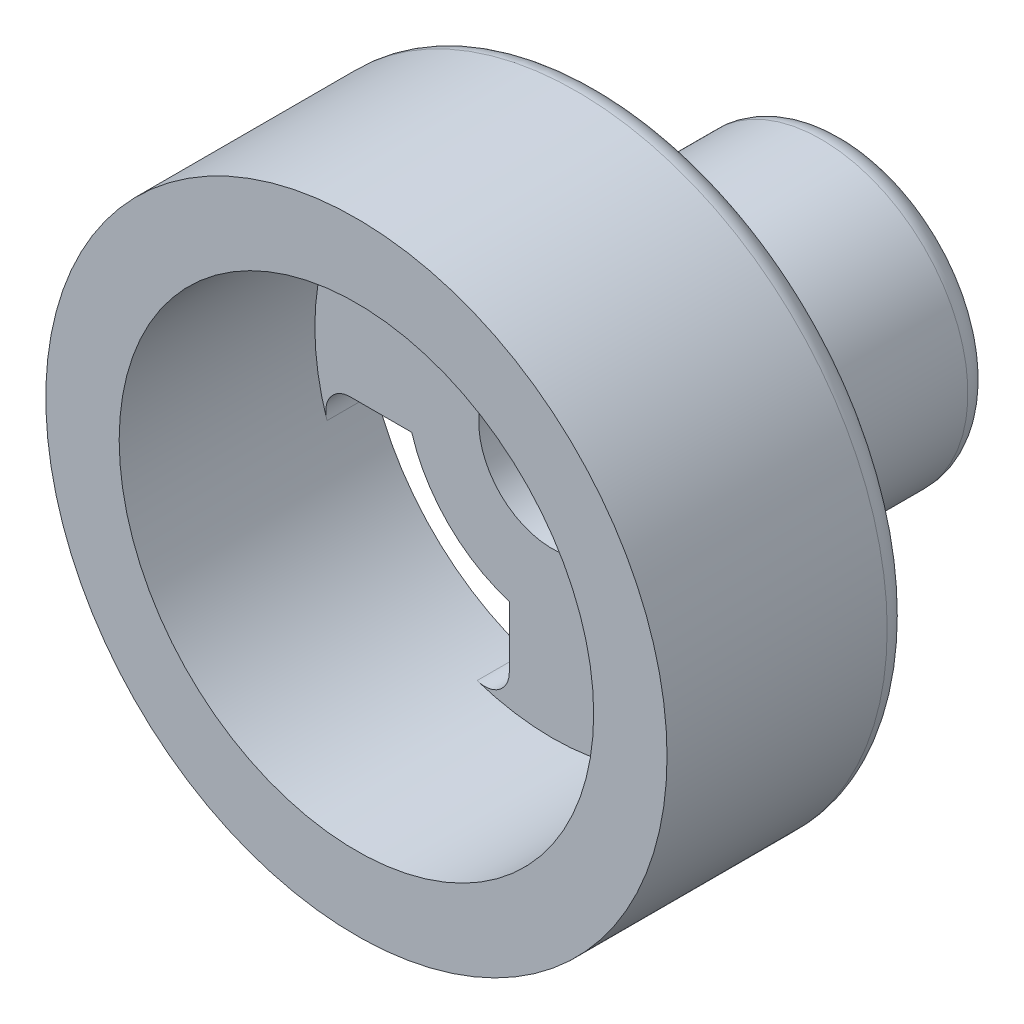
from build123d import *
from build123d.topology import SkipClean

# Parameters (mm, degrees)
ESBO_O1_R                = 12.7
ESBO_O1_R_2              = 9.7
ESBO_O1_R_3              = 3
RESSALTO_EXTRUS_O1_DEPTH = 10
ESBO_O1_3_R              = 9.7
ESBO_O1_3_R_2            = 3
CORTE_EXTRUS_O1_DEPTH    = 8
CORTE_EXTRUS_O3_START    = -2
CORTE_EXTRUS_O3_DEPTH    = 2
FILETE1_R                = 1
ESBO_O2_5_R              = 6
ESBO_O2_5_R_2            = 3
RESSALTO_EXTRUS_O2_DEPTH = 10
FILETE2_R                = 1
FILETE3_R                = 1
FILETE4_R                = 1


with BuildPart() as part:
    # Esboço1 → Ressalto-extrusão1 (new body)
    # profile 1 of 2: a face of its own
    with BuildSketch(Plane.XY):
        Circle(ESBO_O1_R)
        Circle(ESBO_O1_R_2, mode=Mode.SUBTRACT)
    # profile 2 of 2: a face of its own
    with BuildSketch(Plane.XY):
        Circle(ESBO_O1_R_2)
        Circle(ESBO_O1_R_3, mode=Mode.SUBTRACT)
    extrude(amount=-RESSALTO_EXTRUS_O1_DEPTH)

    # Esboço1<3> → Corte-extrusão1 (cut)
    with BuildSketch(Plane.XY):
        Circle(ESBO_O1_3_R)
        Circle(ESBO_O1_3_R_2, mode=Mode.SUBTRACT)
    extrude(amount=-CORTE_EXTRUS_O1_DEPTH, mode=Mode.SUBTRACT)

    # Esboço2 → Corte-extrusão3 (cut)
    with SkipClean():  # the faces are left unmerged after this step: merging them gives an invalid solid
        with BuildSketch(Plane(origin=(0, 0, -10), x_dir=(-1, 0, 0), z_dir=(0, 0, -1)).offset(CORTE_EXTRUS_O3_START)):
            with BuildLine():
                Line((-1.75, -9.540833), (-1.75, -5.73912))
                ThreePointArc((-1.75, -5.73912), (-4.242641, -4.242641), (-5.73912, -1.75))
                Line((-5.73912, -1.75), (-9.540833, -1.75))
                ThreePointArc((-9.540833, -1.75), (-6.858936, -6.858936), (-1.75, -9.540833))
            make_face()
            with BuildLine():
                Line((-9.540833, 1.75), (-5.73912, 1.75))
                ThreePointArc((-5.73912, 1.75), (-4.242641, 4.242641), (-1.75, 5.73912))
                Line((-1.75, 5.73912), (-1.75, 9.540833))
                ThreePointArc((-1.75, 9.540833), (-6.858936, 6.858936), (-9.540833, 1.75))
            make_face()
            with BuildLine():
                Line((5.73912, 1.75), (9.540833, 1.75))
                ThreePointArc((9.540833, 1.75), (6.858936, 6.858936), (1.75, 9.540833))
                Line((1.75, 9.540833), (1.75, 5.73912))
                ThreePointArc((1.75, 5.73912), (4.242641, 4.242641), (5.73912, 1.75))
            make_face()
            with BuildLine():
                ThreePointArc((1.75, -9.540833), (6.858936, -6.858936), (9.540833, -1.75))
                Line((9.540833, -1.75), (5.73912, -1.75))
                ThreePointArc((5.73912, -1.75), (4.242641, -4.242641), (1.75, -5.73912))
                Line((1.75, -5.73912), (1.75, -9.540833))
            make_face()
        extrude(amount=CORTE_EXTRUS_O3_DEPTH, mode=Mode.SUBTRACT)

    # Filete1
    filete1_edges = [part.edges().sort_by_distance(p)[0] for p in [
        (-9.540833, -1.75, -9),
        (-1.75, -9.540833, -9),
        (-1.75, 9.540833, -9),
        (-9.540833, 1.75, -9),
        (9.540833, 1.75, -9),
        (1.75, 9.540833, -9),
        (1.75, -9.540833, -9),
        (9.540833, -1.75, -9),
    ]]
    fillet(filete1_edges, radius=FILETE1_R)

    # Esboço2<5> → Ressalto-extrusão2 (add)
    with SkipClean():  # the faces are left unmerged after this step: merging them gives an invalid solid
        with BuildSketch(Plane(origin=(0, 0, -10), x_dir=(-1, 0, 0), z_dir=(0, 0, -1))):
            Circle(ESBO_O2_5_R)
            with Locations(Location((0, 0, 0), (0, 0, 180))):
                Circle(ESBO_O2_5_R_2, mode=Mode.SUBTRACT)
        extrude(amount=RESSALTO_EXTRUS_O2_DEPTH)

    # Filete2
    # the kernel refuses this fillet: 1 mm, written as the material it adds along each edge
    with BuildSketch(Plane(origin=(0, 0, -10), x_dir=(-1, 0, 0), z_dir=(0, -1, 0))) as filete2_piece_1_section:
        with BuildLine():
            CenterArc((6 + FILETE2_R, FILETE2_R), FILETE2_R, 180, 90)
            Line((6, FILETE2_R), (6, 0))
            Line((6, 0), (6 + FILETE2_R, 0))
        make_face()
    filete2_piece_1 = revolve(axis=Axis((0, 0, -10), (0, 0, -1)), revolution_arc=40.831345, mode=Mode.PRIVATE)
    filete2_piece_1 = split(filete2_piece_1, bisect_by=Plane(origin=(-6.142197, 1.75, -10.226515), z_dir=(0, -1, 0)), keep=Keep.TOP, mode=Mode.PRIVATE)
    add(filete2_piece_1)
    with BuildSketch(Plane(origin=(0, 0, -10), x_dir=(0.6538481250913037, -0.7566258185619804, 0), z_dir=(0.7566258185619804, 0.6538481250913037, 0))) as filete2_piece_2_section:
        with BuildLine():
            CenterArc((6 + FILETE2_R, FILETE2_R), FILETE2_R, 180, 90)
            Line((6, FILETE2_R), (6, 0))
            Line((6, 0), (6 + FILETE2_R, 0))
        make_face()
    filete2_piece_2 = revolve(axis=Axis((0, 0, -10), (0, 0, -1)), revolution_arc=81.664733, mode=Mode.PRIVATE)
    filete2_piece_2 = split(filete2_piece_2, bisect_by=Plane(origin=(-1.75, -6.142197, -10.226515), z_dir=(1, 0, 0)), keep=Keep.TOP, mode=Mode.PRIVATE)
    filete2_piece_2 = split(filete2_piece_2, bisect_by=Plane(origin=(1.75, -6.142197, -10.226515), z_dir=(-1, 0, 0)), keep=Keep.TOP, mode=Mode.PRIVATE)
    add(filete2_piece_2)
    with BuildSketch(Plane(origin=(0, 0, -10), x_dir=(0.7566258185619548, 0.6538481250913332, 0), z_dir=(-0.6538481250913332, 0.7566258185619548, 0))) as filete2_piece_3_section:
        with BuildLine():
            CenterArc((6 + FILETE2_R, FILETE2_R), FILETE2_R, 180, 90)
            Line((6, FILETE2_R), (6, 0))
            Line((6, 0), (6 + FILETE2_R, 0))
        make_face()
    filete2_piece_3 = revolve(axis=Axis((0, 0, -10), (0, 0, -1)), revolution_arc=81.664733, mode=Mode.PRIVATE)
    filete2_piece_3 = split(filete2_piece_3, bisect_by=Plane(origin=(6.142197, -1.75, -10.226515), z_dir=(0, 1, 0)), keep=Keep.TOP, mode=Mode.PRIVATE)
    filete2_piece_3 = split(filete2_piece_3, bisect_by=Plane(origin=(6.142197, 1.75, -10.226515), z_dir=(0, -1, 0)), keep=Keep.TOP, mode=Mode.PRIVATE)
    add(filete2_piece_3)
    with BuildSketch(Plane(origin=(0, 0, -10), x_dir=(-0.6538481250913029, 0.7566258185619811, 0), z_dir=(-0.7566258185619811, -0.6538481250913029, 0))) as filete2_piece_4_section:
        with BuildLine():
            CenterArc((6 + FILETE2_R, FILETE2_R), FILETE2_R, 180, 90)
            Line((6, FILETE2_R), (6, 0))
            Line((6, 0), (6 + FILETE2_R, 0))
        make_face()
    filete2_piece_4 = revolve(axis=Axis((0, 0, -10), (0, 0, -1)), revolution_arc=81.664733, mode=Mode.PRIVATE)
    filete2_piece_4 = split(filete2_piece_4, bisect_by=Plane(origin=(1.75, 6.142197, -10.226515), z_dir=(-1, 0, 0)), keep=Keep.TOP, mode=Mode.PRIVATE)
    filete2_piece_4 = split(filete2_piece_4, bisect_by=Plane(origin=(-1.75, 6.142197, -10.226515), z_dir=(1, 0, 0)), keep=Keep.TOP, mode=Mode.PRIVATE)
    add(filete2_piece_4)
    with BuildSketch(Plane(origin=(0, 0, -10), x_dir=(-0.7566374717500711, -0.6538346399080277, 0), z_dir=(0.6538346399080277, -0.7566374717500711, 0))) as filete2_piece_5_section:
        with BuildLine():
            CenterArc((6 + FILETE2_R, FILETE2_R), FILETE2_R, 180, 90)
            Line((6, FILETE2_R), (6, 0))
            Line((6, 0), (6 + FILETE2_R, 0))
        make_face()
    filete2_piece_5 = revolve(axis=Axis((0, 0, -10), (0, 0, -1)), revolution_arc=40.831345, mode=Mode.PRIVATE)
    filete2_piece_5 = split(filete2_piece_5, bisect_by=Plane(origin=(-6.142196, -1.75, -10.226515), z_dir=(0, 1, 0)), keep=Keep.TOP, mode=Mode.PRIVATE)
    add(filete2_piece_5)

    # Filete3
    filete3_edges = [part.edges().sort_by_distance(p)[0] for p in [
        (6, 0, -20),
    ]]
    fillet(filete3_edges, radius=FILETE3_R)

    # Filete4
    filete4_edges = [part.edges().sort_by_distance(p)[0] for p in [
        (-12.7, 0, -10),
    ]]
    fillet(filete4_edges, radius=FILETE4_R)


solid = part.part
